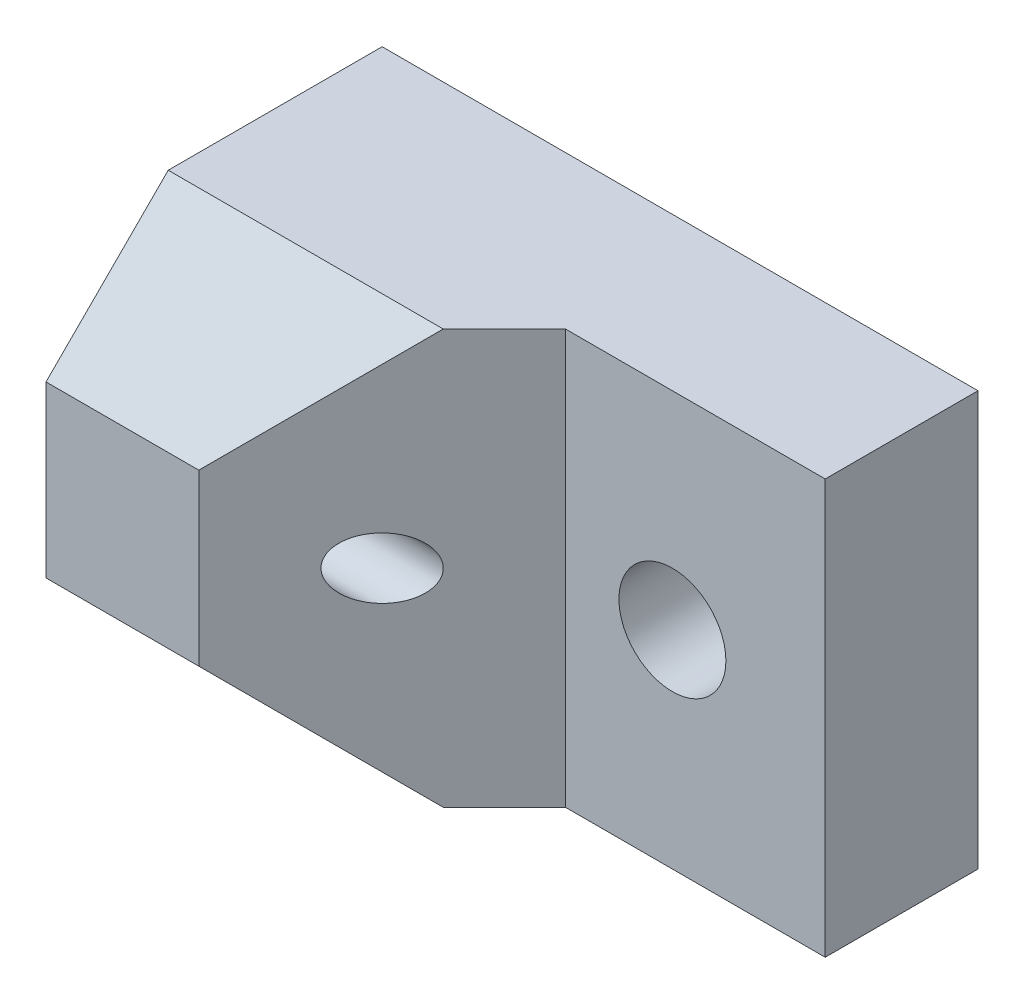
from build123d import *

# Parameters (mm, degrees)
SKETCH1_W           = 19.5
SKETCH1_H           = 13.556349186
SKETCH1_R           = 1.75
BOSS_EXTRUDE1_DEPTH = 5
SKETCH2_W           = 6
SKETCH2_H           = 3
BOSS_EXTRUDE2_DEPTH = 2
SKETCH3_W           = 6
SKETCH3_H           = 13.556349186
SKETCH3_R           = 1
BOSS_EXTRUDE3_DEPTH = 5
CHAMFER1_SIZE       = 4
CHAMFER2_SIZE       = 6


with BuildPart() as part:
    # Sketch1 → Boss-Extrude1 (new body)
    with BuildSketch(Plane.XY):
        with Locations((-25.671858451, -15.778174593)):
            Rectangle(SKETCH1_W, SKETCH1_H)
        with Locations((-20.921858451, -15.778174593)):
            Circle(SKETCH1_R, mode=Mode.SUBTRACT)
    extrude(amount=BOSS_EXTRUDE1_DEPTH)

    # Sketch2 → Boss-Extrude2 (add)
    with BuildSketch(Plane(origin=(0, 0, 0), x_dir=(-1, 0, 0), z_dir=(0, 0, -1))):
        with Locations((32.421858451, -15.778174593)):
            Rectangle(SKETCH2_W, SKETCH2_H)
    extrude(amount=BOSS_EXTRUDE2_DEPTH)

    # Sketch3 → Boss-Extrude3 (add)
    with BuildSketch(Plane.ZY.offset(35.421858451)):
        with Locations((8, -15.778174593)):
            Rectangle(SKETCH3_W, SKETCH3_H)
        with Locations((8, -15.778174593)):
            Circle(SKETCH3_R, mode=Mode.SUBTRACT)
    extrude(amount=-BOSS_EXTRUDE3_DEPTH)

    # Chamfer1
    chamfer1_edges = [part.edges().sort_by_distance(p)[0] for p in [
        (-32.921858451, -9, 11),
        (-32.921858451, -22.556349186, 11),
    ]]
    chamfer(chamfer1_edges, length=CHAMFER1_SIZE)

    # Chamfer2
    # the kernel refuses this chamfer: 6 mm, written as the material it adds along each edge
    with BuildSketch(Plane(origin=(-30.421858451, -22.556349186, 5), x_dir=(-0.0274958766105862, 0, 0.9996219169112968), z_dir=(0, 1, 0))) as chamfer2_piece_1_section:
        Polygon((CHAMFER2_SIZE * 0.999621916911, CHAMFER2_SIZE * 0.0274958766106), (-CHAMFER2_SIZE * 0.0274958766106, CHAMFER2_SIZE * 0.999621916911), (0, 0), align=None)
    chamfer2_piece_1 = extrude(amount=13.556349186, mode=Mode.PRIVATE)
    chamfer2_piece_1 = split(chamfer2_piece_1, bisect_by=Plane(origin=(-28.301106776, -12.243149914, 10.243149914), z_dir=(0, -0.7071067811865477, -0.7071067811865474)), keep=Keep.TOP, mode=Mode.PRIVATE)
    chamfer2_piece_1 = split(chamfer2_piece_1, bisect_by=Plane(origin=(-28.301106776, -15.778174309, 11), z_dir=(0, 0, -1)), keep=Keep.TOP, mode=Mode.PRIVATE)
    chamfer2_piece_1 = split(chamfer2_piece_1, bisect_by=Plane(origin=(-28.301106776, -19.313198988, 10.243150199), z_dir=(0, 0.7071067811865474, -0.7071067811865477)), keep=Keep.TOP, mode=Mode.PRIVATE)
    chamfer2_piece_1 = chamfer2_piece_1 - Plane(origin=(-28.301106776, -15.778174593, 8), x_dir=(0, 0, 1), z_dir=(-1, 0, 0)) * Cylinder(1, 52, mode=Mode.PRIVATE)
    add(chamfer2_piece_1)


solid = part.part
